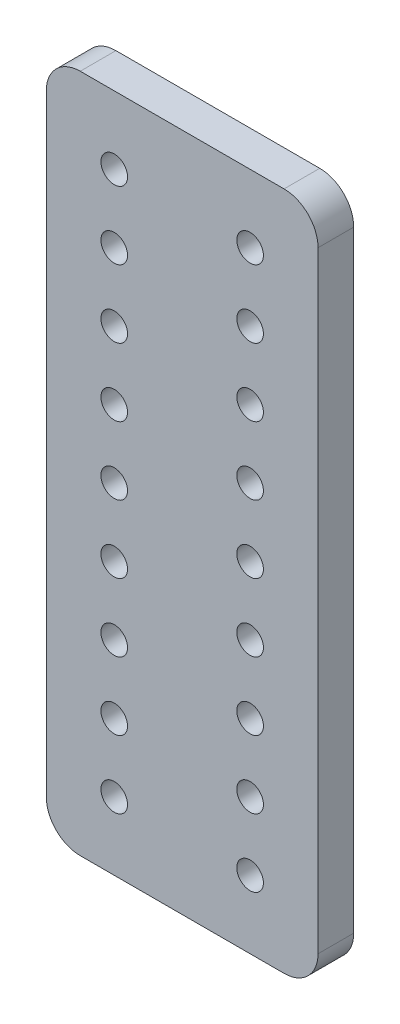
from build123d import *

# Parameters (mm, degrees)
SKETCH2_W           = 50.8
SKETCH2_H           = 127
BOSS_EXTRUDE1_DEPTH = 6.6675
SKETCH3_R           = 2.4892
CUT_EXTRUDE1_DEPTH  = 137.945593417
FILLET1_R           = 6.35


with BuildPart() as part:
    # Sketch2 → Boss-Extrude1 (new body)
    with BuildSketch(Plane.XY):
        with Locations((25.4, 63.5)):
            Rectangle(SKETCH2_W, SKETCH2_H)
    extrude(amount=-BOSS_EXTRUDE1_DEPTH)

    # Sketch3 → Cut-Extrude1 (cut, through all)
    with BuildSketch(Plane.XY):
        with Locations((12.7, 114.3)):
            Circle(SKETCH3_R)
        with Locations((12.7, 101.6)):
            Circle(SKETCH3_R)
        with Locations((12.7, 88.9)):
            Circle(SKETCH3_R)
        with Locations((12.7, 76.2)):
            Circle(SKETCH3_R)
        with Locations((12.7, 63.5)):
            Circle(SKETCH3_R)
        with Locations((12.7, 50.8)):
            Circle(SKETCH3_R)
        with Locations((12.7, 38.1)):
            Circle(SKETCH3_R)
        with Locations((12.7, 25.4)):
            Circle(SKETCH3_R)
        with Locations((12.7, 12.7)):
            Circle(SKETCH3_R)
        with Locations((38.1, 101.6)):
            Circle(SKETCH3_R)
        with Locations((38.1, 88.9)):
            Circle(SKETCH3_R)
        with Locations((38.1, 76.2)):
            Circle(SKETCH3_R)
        with Locations((38.1, 63.5)):
            Circle(SKETCH3_R)
        with Locations((38.1, 50.8)):
            Circle(SKETCH3_R)
        with Locations((38.1, 38.1)):
            Circle(SKETCH3_R)
        with Locations((38.1, 25.4)):
            Circle(SKETCH3_R)
        with Locations((38.1, 12.7)):
            Circle(SKETCH3_R)
        with Locations((38.1, 114.3)):
            Circle(SKETCH3_R)
    extrude(amount=-CUT_EXTRUDE1_DEPTH, mode=Mode.SUBTRACT)

    # Fillet1
    fillet1_edges = [part.edges().sort_by_distance(p)[0] for p in [
        (0, 0, -3.33375),
        (50.8, 0, -3.33375),
        (50.8, 127, -3.33375),
        (0, 127, -3.33375),
    ]]
    fillet(fillet1_edges, radius=FILLET1_R)


solid = part.part
